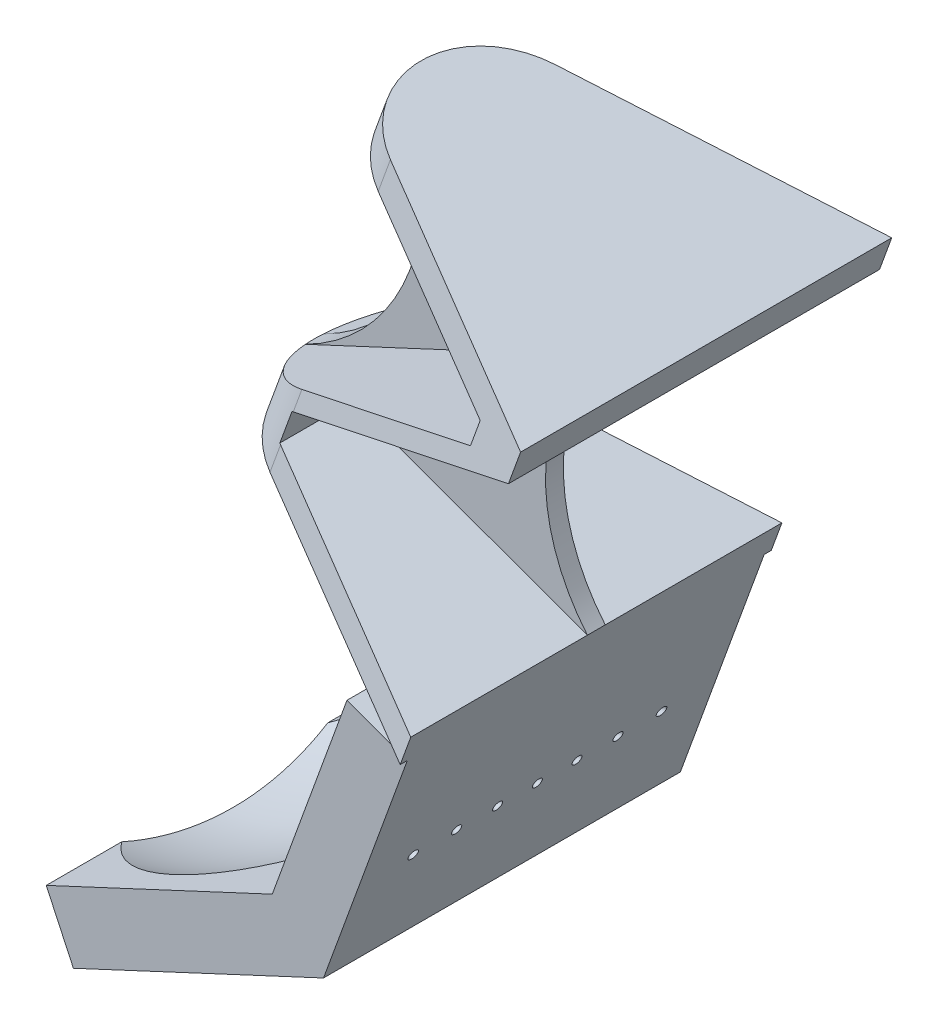
from build123d import *

# Parameters (mm, degrees)
BOSS_EXTRUDE1_DEPTH             = 156
BOSS_EXTRUDE2_DEPTH             = 150
RIB4_START                      = -7.5
RIB4_DEPTH                      = 15
RIB7_START                      = -7.5
RIB7_DEPTH                      = 15
SKETCH2_OUTSIDE_W               = 773.543
SKETCH2_OUTSIDE_H               = 480.472
CUT_EXTRUDE3_DEPTH              = 296
F_8_0MM_DOWEL_SLOT1_D           = 8
F_8_0MM_DOWEL_SLOT1_DEPTH       = 161.447952075
CIRPATTERN1_COUNT               = 4
CIRPATTERN1_ANGLE               = 21
CIRPATTERN1_THE_OTHER_WAY_COUNT = 4
CIRPATTERN1_THE_OTHER_WAY_ANGLE = 21


# Read off the part's stored shape, not the designer's step: Rib4, Rib7
with BuildPart() as part:
    # Sketch1 → Boss-Extrude1 (new, symmetric)
    with BuildSketch(Plane.XY):
        Polygon((-188.878216778, 425.746048808), (0, 357), (50.743401522, 338.53091226), (59.635925249, 362.962920401), (-137.699525116, 434.787150499), (-127.438920816, 462.977929123), (141.720759647, 588.489149389), (151.981363947, 616.679928013), (-87.640254354, 703.895064561), (-97.900858653, 675.704285938), (99.234246017, 603.952975709), (91.025762577, 581.40035281), (-177.860652322, 456.016558369), align=None)
    extrude(amount=BOSS_EXTRUDE1_DEPTH, both=True)

    # Sketch1<3> → Boss-Extrude2 (add, symmetric)
    with BuildSketch(Plane.XY):
        Polygon((50.743401522, 338.53091226), (0, 357), (-62.806002899, 184.44192523), (-252.797540729, 95.847416155), (-229.976154595, 46.906795655), (-19.712748003, 144.954232379), align=None)
    extrude(amount=BOSS_EXTRUDE2_DEPTH, both=True)

    # Rib4 outline → Rib4 (add)
    with BuildSketch(Plane.XY.offset(RIB4_START)):
        with BuildLine():
            ThreePointArc((-86.812742488, 671.668541699), (-92.494207805, 547.02111698), (-177.860652322, 456.016558369))
            Line((-177.860652322, 456.016558369), (91.025762577, 581.40035281))
            Line((91.025762577, 581.40035281), (99.234246017, 603.952975709))
            Line((99.234246017, 603.952975709), (-86.812742488, 671.668541699))
        make_face()
    extrude(amount=RIB4_DEPTH)

    # Rib7 outline → Rib7 (add)
    with BuildSketch(Plane.XY.offset(RIB7_START)):
        with BuildLine():
            Line((-137.699525116, 434.787150499), (59.635925249, 362.962920401))
            ThreePointArc((59.635925249, 362.962920401), (24.532406899, 453.689085613), (52.471024074, 546.871314203))
            Line((52.471024074, 546.871314203), (-127.438920816, 462.977929123))
            Line((-127.438920816, 462.977929123), (-137.699525116, 434.787150499))
        make_face()
    extrude(amount=RIB7_DEPTH)

    # Sketch2 outside → Cut-Extrude3 (cut)
    with BuildSketch(Plane(origin=(215.975550753, 593.387948849, 0), x_dir=(0.9396926207859096, -0.34202014332566555, 0), z_dir=(0.34202014332566555, 0.9396926207859096, 0))):
        with Locations((-175.7625, 0)):
            Rectangle(SKETCH2_OUTSIDE_W, SKETCH2_OUTSIDE_H)
        with BuildLine():
            Line((-68.101191167, 156), (-276.876674428, 69.260172994))
            ThreePointArc((-276.876674428, 69.260172994), (-323.101191167, 0), (-276.876674428, -69.260172994))
            Line((-276.876674428, -69.260172994), (-68.101191167, -156))
            Line((-68.101191167, -156), (-68.101191167, 156))
        make_face(mode=Mode.SUBTRACT)
    extrude(amount=-CUT_EXTRUDE3_DEPTH, mode=Mode.SUBTRACT)

    # Ø8.0mm Dowel Slot1
    with Locations(Plane(origin=(-114.737588329, 41.761066903, 0), x_dir=(0, 0, 1), z_dir=(-0.9396926207859094, 0.3420201433256659, 0))):
        with Locations((0, 216.442420257)):
            f_8_0mm_dowel_slot1 = Hole(F_8_0MM_DOWEL_SLOT1_D / 2, depth=F_8_0MM_DOWEL_SLOT1_DEPTH)

    # CirPattern1: Ø8.0mm Dowel Slot1 ×4 about axis
    cirpattern1_axis = Axis((-252.797540729, 300, 0), (0.34202014332566444, 0.93969262078591, 0))
    for i in range(1, CIRPATTERN1_COUNT):
        add(f_8_0mm_dowel_slot1.rotate(cirpattern1_axis, i * CIRPATTERN1_ANGLE / (CIRPATTERN1_COUNT - 1)), mode=Mode.SUBTRACT)

    # CirPattern1 the other way: Ø8.0mm Dowel Slot1 ×4 about axis
    cirpattern1_the_other_way_axis = Axis((-252.797540729, 300, 0), (-0.34202014332566444, -0.93969262078591, 0))
    for i in range(1, CIRPATTERN1_THE_OTHER_WAY_COUNT):
        add(f_8_0mm_dowel_slot1.rotate(cirpattern1_the_other_way_axis, i * CIRPATTERN1_THE_OTHER_WAY_ANGLE / (CIRPATTERN1_THE_OTHER_WAY_COUNT - 1)), mode=Mode.SUBTRACT)

    # Sketch8 → Cut-Revolve2 (revolve, cut)
    with BuildSketch(Plane.XY):
        with BuildLine():
            Line((-305.729863532, 209.361148723), (-245.866997039, 80.984817248))
            ThreePointArc((-245.866997039, 80.984817248), (-71.913486681, 163.178598204), (-4.90395464, 343.526495362))
            Line((-4.90395464, 343.526495362), (-227.420005778, 424.515714622))
            Line((-227.420005778, 424.515714622), (-305.729863532, 209.361148723))
        make_face()
    revolve(axis=Axis((-227.420005778, 424.515714622, 0), (-0.3420201433256654, -0.9396926207859096, 0)), mode=Mode.SUBTRACT)


solid = part.part
